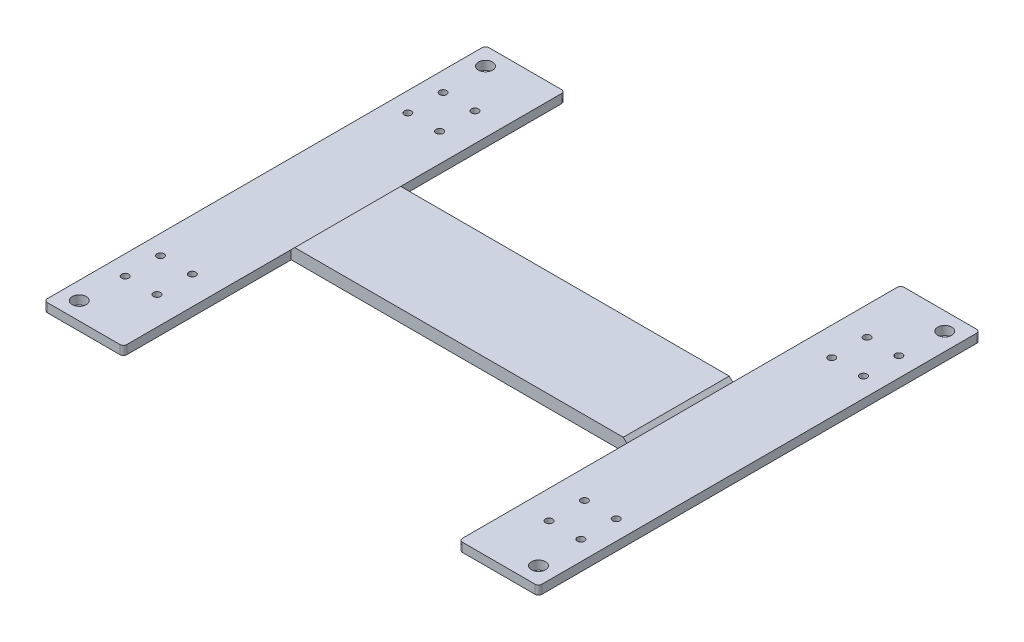
from build123d import *

# Parameters (mm, degrees)
SKETCH1_W             = 45
SKETCH1_H             = 250
BOSS_EXTRUDE1_DEPTH   = 5
BOSS_EXTRUDE1_2_DEPTH = 5
SKETCH2_W             = 190
SKETCH2_H             = 60
BOSS_EXTRUDE2_DEPTH   = 7
CHAMFER1_SIZE         = 2
FILLET1_R             = 2
SKETCH3_R             = 2
CUT_EXTRUDE1_DEPTH    = 188.749833555
LPATTERN1_COUNT       = 2
LPATTERN1_PITCH       = 240
LPATTERN1_COUNT_DIR2  = 2
LPATTERN1_PITCH_DIR2  = 160
SKETCH4_R             = 4
CUT_EXTRUDE2_DEPTH    = 188.749833555
LPATTERN2_COUNT       = 2
LPATTERN2_PITCH       = 260
LPATTERN2_COUNT_DIR2  = 2
LPATTERN2_PITCH_DIR2  = 230


with BuildPart() as part:
    # Sketch1 → Boss-Extrude1 (new body)
    with BuildSketch(Plane(origin=(0, 0, 0), x_dir=(1, 0, 0), z_dir=(0, 1, 0))):
        with Locations((-117.5, 0)):
            Rectangle(SKETCH1_W, SKETCH1_H)
    extrude(amount=BOSS_EXTRUDE1_DEPTH)



with BuildPart() as body_2:
    # Sketch1 → Boss-Extrude1 2 (new body)
    with BuildSketch(Plane(origin=(0, 0, 0), x_dir=(1, 0, 0), z_dir=(0, 1, 0))):
        with Locations((117.5, 0)):
            Rectangle(SKETCH1_W, SKETCH1_H)
    extrude(amount=BOSS_EXTRUDE1_2_DEPTH)


with BuildPart() as part_1:
    add(part.part)

    add(body_2.part)  # Boss-Extrude2 merges body 2
    # Sketch2 → Boss-Extrude2 (add)
    with BuildSketch(Plane(origin=(0, 0, 0), x_dir=(1, 0, 0), z_dir=(0, 1, 0))):
        Rectangle(SKETCH2_W, SKETCH2_H)
    extrude(amount=BOSS_EXTRUDE2_DEPTH)

    # Chamfer1
    chamfer1_edges = [part_1.edges().sort_by_distance(p)[0] for p in [
        (95, 7, 0),
        (-95, 7, 0),
    ]]
    chamfer(chamfer1_edges, length=CHAMFER1_SIZE - 0.0001)  # a hair under: the kernel refuses the full size

    # Fillet1
    fillet1_edges = [part_1.edges().sort_by_distance(p)[0] for p in [
        (95, 2.5, -125),
        (95, 2.5, 125),
        (140, 2.5, 125),
        (140, 2.5, -125),
        (-95, 2.5, -125),
        (-95, 2.5, 125),
        (-140, 2.5, 125),
        (-140, 2.5, -125),
    ]]
    fillet(fillet1_edges, radius=FILLET1_R)

    # Sketch3 → Cut-Extrude1 (cut, through all)
    with BuildSketch(Plane(origin=(0, 5, 0), x_dir=(1, 0, 0), z_dir=(0, 1, 0))):
        with Locations(Location((-129, 90, 0), (0, 0, 270))):
            Circle(SKETCH3_R)
        with Locations(Location((-111, 90, 0), (0, 0, 270))):
            Circle(SKETCH3_R)
        with Locations(Location((-129, 70, 0), (0, 0, 270))):
            Circle(SKETCH3_R)
        with Locations(Location((-111, 70, 0), (0, 0, 270))):
            Circle(SKETCH3_R)
    cut_extrude1 = extrude(amount=-CUT_EXTRUDE1_DEPTH, mode=Mode.SUBTRACT)

    # LPattern1: Cut-Extrude1 2 × 2
    with Locations(*[(i * LPATTERN1_PITCH, 0, j * LPATTERN1_PITCH_DIR2) for i in range(LPATTERN1_COUNT) for j in range(LPATTERN1_COUNT_DIR2) if (i, j) != (0, 0)]):
        add(cut_extrude1, mode=Mode.SUBTRACT)

    # Sketch4 → Cut-Extrude2 (cut, through all)
    with BuildSketch(Plane(origin=(0, 5, 0), x_dir=(1, 0, 0), z_dir=(0, 1, 0))):
        with Locations(Location((-130, 115, 0), (0, 0, 270))):
            Circle(SKETCH4_R)
    cut_extrude2 = extrude(amount=-CUT_EXTRUDE2_DEPTH, mode=Mode.SUBTRACT)

    # LPattern2: Cut-Extrude2 2 × 2
    with Locations(*[(i * LPATTERN2_PITCH, 0, j * LPATTERN2_PITCH_DIR2) for i in range(LPATTERN2_COUNT) for j in range(LPATTERN2_COUNT_DIR2) if (i, j) != (0, 0)]):
        add(cut_extrude2, mode=Mode.SUBTRACT)


solid = part_1.part
